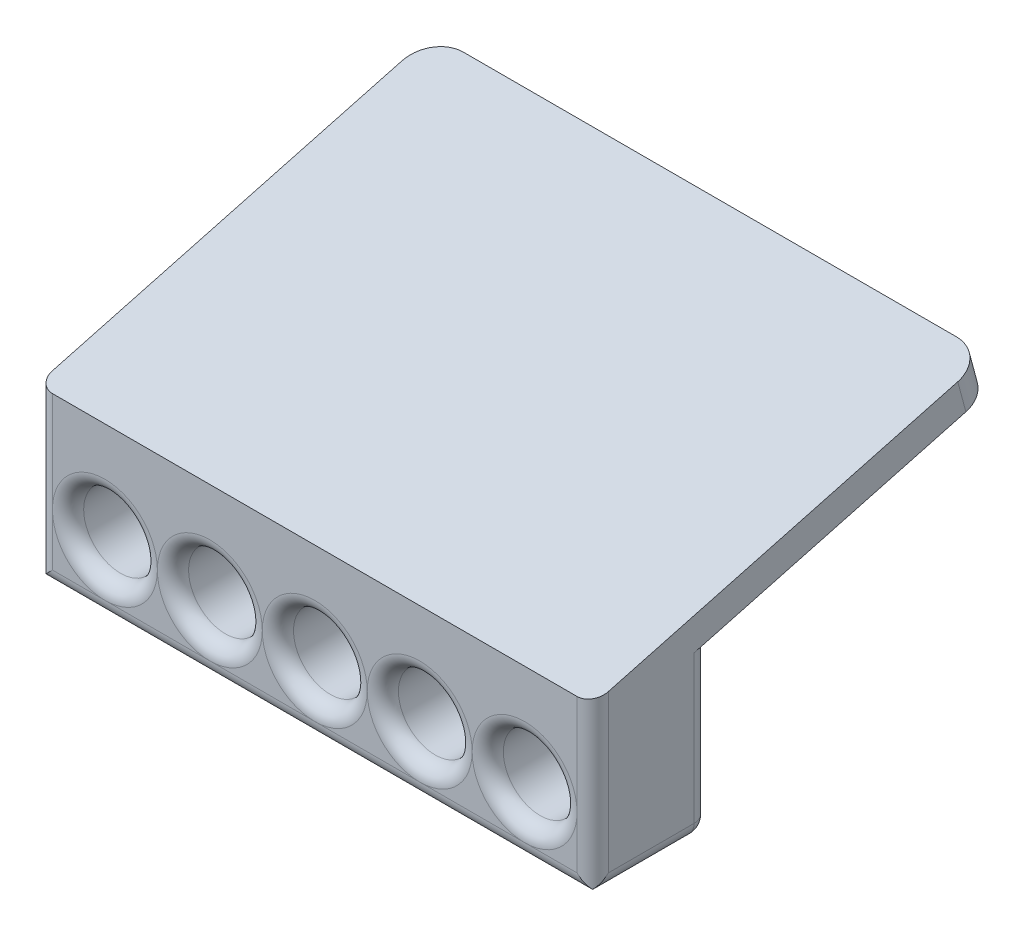
from build123d import *
from build123d.topology import SkipClean

# Parameters (mm, degrees)
SKETCH1_W               = 45.23994
SKETCH1_H               = 11.079988
SKETCH1_R               = 2.999994
BOSS_EXTRUDE1_DEPTH     = 9.525
BOSS_EXTRUDE2_DEPTH     = 45.23994
FILLET1_R               = 1.27
FILLET2_R               = 1.27
FILLET3_R               = 1.27
FILLET4_R               = 1.27
BOSS_EXTRUDE3_DEPTH     = 2.54
CUT_EXTRUDE1_DEPTH      = 52.163776393
CUT_EXTRUDE1_DEPTH_BACK = 52.163776393
FILLET5_R               = 2.54


# Some blends are built 0.0001 mm under size
with BuildPart() as part:
    # Sketch1 → Boss-Extrude1 (new body)
    with BuildSketch(Plane.XY):
        with Locations((17.079976, 0)):
            Rectangle(SKETCH1_W, SKETCH1_H)
        with Locations(Location((0, 0, 0), (0, 0, 180))):
            Circle(SKETCH1_R, mode=Mode.SUBTRACT)
        with Locations(Location((8.539988, 0, 0), (0, 0, 180))):
            Circle(SKETCH1_R, mode=Mode.SUBTRACT)
        with Locations(Location((17.079976, 0, 0), (0, 0, 180))):
            Circle(SKETCH1_R, mode=Mode.SUBTRACT)
        with Locations(Location((25.619964, 0, 0), (0, 0, 180))):
            Circle(SKETCH1_R, mode=Mode.SUBTRACT)
        with Locations(Location((34.159952, 0, 0), (0, 0, 180))):
            Circle(SKETCH1_R, mode=Mode.SUBTRACT)
    extrude(amount=BOSS_EXTRUDE1_DEPTH)

    # Sketch2 → Boss-Extrude2 (add)
    with BuildSketch(Plane(origin=(39.699946, 0, 0), x_dir=(0, 0, -1), z_dir=(1, 0, 0))):
        Polygon((-9.525, 5.539994), (0, 8.092210058), (0, 5.539994), align=None)
    extrude(amount=-BOSS_EXTRUDE2_DEPTH)

    # Fillet1
    fillet1_edges = [part.edges().sort_by_distance(p)[0] for p in [
        (39.699946, -5.539994, 4.7625),
        (-5.539994, -5.539994, 4.7625),
    ]]
    fillet(fillet1_edges, radius=FILLET1_R)

    # Fillet2
    # the kernel refuses this fillet: 1.27 mm, written as the material it takes off along each edge
    with BuildSketch(Plane(origin=(38.429946, -5.539994, 0), x_dir=(0, 0, 1), z_dir=(-1, 0, 0))) as fillet2_piece_1:
        with BuildLine():
            CenterArc((FILLET2_R, FILLET2_R), FILLET2_R, 180, 90)
            Line((0, FILLET2_R), (0, 0))
            Line((0, 0), (FILLET2_R, 0))
        make_face()
    extrude(amount=42.69994, mode=Mode.SUBTRACT)
    with BuildSketch(Plane(origin=(41.604946, -5.539994, 9.525), x_dir=(0, 0, -1), z_dir=(-1, 0, 0))) as fillet2_piece_2:
        with BuildLine():
            CenterArc((FILLET2_R, -FILLET2_R), FILLET2_R, 90, 90)
            Line((0, -FILLET2_R), (0, 0))
            Line((0, 0), (FILLET2_R, 0))
        make_face()
    extrude(amount=49.04994, mode=Mode.SUBTRACT)
    with BuildSketch(Plane(origin=(39.699946, -4.269994, 0), x_dir=(-1, 0, 0), z_dir=(0, 1, 0)), Plane(origin=(-5.539994, 11.267210058, 0), x_dir=(1, 0, 0), z_dir=(0, -1, 0))) as fillet2_piece_3:
        with BuildLine():
            CenterArc((FILLET2_R, FILLET2_R), FILLET2_R, 180, 90)
            Line((0, FILLET2_R), (0, 0))
            Line((0, 0), (FILLET2_R, 0))
        make_face()
    extrude(amount=15.537204058, mode=Mode.SUBTRACT)
    with BuildSketch(Plane(origin=(38.429946, -4.269994, 0), x_dir=(0, -1, 0), z_dir=(-1, 0, 0))) as fillet2_piece_4:
        with BuildLine():
            CenterArc((1.27 - FILLET2_R, FILLET2_R), FILLET2_R, 270, 90)
            Line((1.27, FILLET2_R), (1.27, 0))
            Line((1.27, 0), (1.27 - FILLET2_R, 0))
        make_face()
    revolve(axis=Axis((38.429946, -4.269994, 0), (0, 0, 1)), revolution_arc=90, mode=Mode.SUBTRACT)
    with BuildSketch(Plane(origin=(-4.269994, -4.269994, 0), x_dir=(0, -1, 0), z_dir=(1, 0, 0))) as fillet2_piece_5:
        with BuildLine():
            CenterArc((1.27 - FILLET2_R, -FILLET2_R), FILLET2_R, 0, 90)
            Line((1.27, -FILLET2_R), (1.27, 0))
            Line((1.27, 0), (1.27 - FILLET2_R, 0))
        make_face()
    revolve(axis=Axis((-4.269994, -4.269994, 0), (0, 0, -1)), revolution_arc=90, mode=Mode.SUBTRACT)

    # Fillet3
    # the kernel refuses this fillet: 1.27 mm, written as the material it takes off along each edge
    with BuildSketch(Plane(origin=(39.699946, 8.714994, 9.525), x_dir=(-1, 0, 0), z_dir=(0, -1, 0))) as fillet3_piece_1:
        with BuildLine():
            CenterArc((FILLET3_R, FILLET3_R), FILLET3_R, 180, 90)
            Line((0, FILLET3_R), (0, 0))
            Line((0, 0), (FILLET3_R, 0))
        make_face()
    extrude(amount=16.159988, mode=Mode.SUBTRACT)
    with BuildSketch(Plane(origin=(-5.539994, -7.444994, 9.525), x_dir=(0, 0, -1), z_dir=(0, 1, 0))) as fillet3_piece_2:
        with BuildLine():
            CenterArc((FILLET3_R, -FILLET3_R), FILLET3_R, 90, 90)
            Line((0, -FILLET3_R), (0, 0))
            Line((0, 0), (FILLET3_R, 0))
        make_face()
    extrude(amount=16.159988, mode=Mode.SUBTRACT)

    # Fillet4
    fillet4_edges = [part.edges().sort_by_distance(p)[0] for p in [
        (2.999994, 0, 0),
        (2.999994, 0, 9.525),
        (11.539982, 0, 0),
        (11.539982, 0, 9.525),
        (20.07997, 0, 0),
        (20.07997, 0, 9.525),
        (28.619958, 0, 0),
        (28.619958, 0, 9.525),
        (37.159946, 0, 0),
        (37.159946, 0, 9.525),
    ]]
    fillet(fillet4_edges, radius=FILLET4_R - 0.0001)  # a hair under: the kernel refuses the full size

    # Sketch3 → Boss-Extrude3 (add)
    with BuildSketch(Plane(origin=(0, 7.55013477, 2.023052514), x_dir=(1, 0, 0), z_dir=(0, 0.96592582628907, 0.2588190451025148))):
        Polygon((-5.539994, 0.779617331), (-5.539994, 26.219495625), (39.699946, 26.219495625), (39.699946, 0.779617331), (39.699946, -7.766587538), (-5.539994, -7.766587538), align=None)
    extrude(amount=BOSS_EXTRUDE3_DEPTH)

    # Sketch4 → Cut-Extrude1 (cut, two sides: drawn at the far end of the back side and taken through both)
    with SkipClean():  # the faces are left unmerged after this step: merging them gives an invalid solid
        with BuildSketch(Plane.XZ.offset(5.539994).offset(-CUT_EXTRUDE1_DEPTH_BACK)):
            with BuildLine():
                Line((-4.269994, 9.525), (38.429946, 9.525))
                ThreePointArc((38.429946, 9.525), (38.915953959, 9.428327006), (39.327971612, 9.153025612))
                ThreePointArc((39.327971612, 9.153025612), (39.603273006, 8.741007959), (39.699946, 8.255))
                Line((39.699946, 8.255), (39.699946, 24.042761525))
                Line((39.699946, 24.042761525), (-5.539994, 24.042761525))
                Line((-5.539994, 24.042761525), (-5.539994, 8.255))
                ThreePointArc((-5.539994, 8.255), (-5.443321006, 8.741007959), (-5.168019612, 9.153025612))
                ThreePointArc((-5.168019612, 9.153025612), (-4.756001959, 9.428327006), (-4.269994, 9.525))
            make_face()
        extrude(amount=CUT_EXTRUDE1_DEPTH + CUT_EXTRUDE1_DEPTH_BACK, mode=Mode.SUBTRACT)

    # Fillet5
    fillet5_edges = [part.edges().sort_by_distance(p)[0] for p in [
        (39.699946, 15.562965391, -22.974335275),
        (-5.539994, 15.562965391, -22.974335275),
    ]]
    fillet(fillet5_edges, radius=FILLET5_R)


solid = part.part
